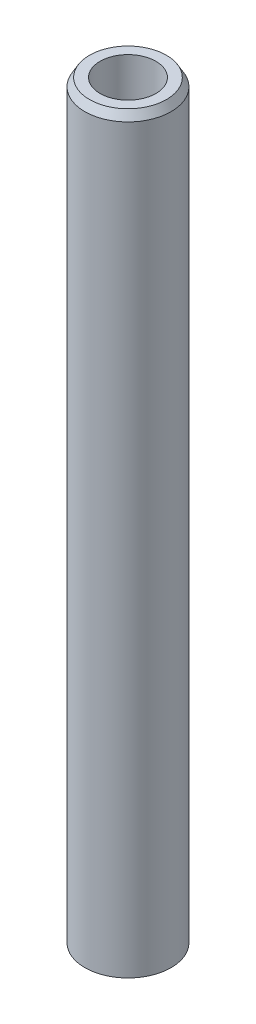
from build123d import *
from OCP.BRepFilletAPI import BRepFilletAPI_MakeChamfer

# Parameters (mm, degrees)
SKETCH1_R           = 22.5
BOSS_EXTRUDE1_DEPTH = 393.426691268
SKETCH2_R           = 14.570755287
CUT_EXTRUDE1_DEPTH  = 395.711364673
CHAMFER1_SIZE       = 4.23519954
CHAMFER1_SIZE2      = 2.445193595


with BuildPart() as part:
    # Sketch1 → Boss-Extrude1 (new body)
    with BuildSketch(Plane(origin=(0, 0, 0), x_dir=(1, 0, 0), z_dir=(0, 1, 0))):
        Circle(SKETCH1_R)
    extrude(amount=BOSS_EXTRUDE1_DEPTH)

    # Sketch2 → Cut-Extrude1 (cut, through all)
    with BuildSketch(Plane(origin=(0, 0, 0), x_dir=(1, 0, 0), z_dir=(0, 1, 0))):
        Circle(SKETCH2_R)
    extrude(amount=CUT_EXTRUDE1_DEPTH, mode=Mode.SUBTRACT)

    # Chamfer1: one chamfer whose edges measure the first distance from different faces: ONE call of the kernel's chamfer builder (chamfer() names one face for all edges)
    chamfer1_edges_1 = [part.edges().sort_by_distance(p)[0] for p in [
        (-22.5, 393.426691268, 0),
    ]]
    chamfer1_side_1 = [part.faces().sort_by_distance(p)[0] for p in [
        (-22.5, 196.713345634, 0),
    ]]
    chamfer1_edges_2 = [part.edges().sort_by_distance(p)[0] for p in [
        (-22.5, 0, 0),
    ]]
    chamfer1_side_2 = [part.faces().sort_by_distance(p)[0] for p in [
        (-21.863603897, 0, 0),
    ]]
    chamfer1 = BRepFilletAPI_MakeChamfer(part.part.solid().wrapped)
    for e in chamfer1_edges_1:
        chamfer1.Add(CHAMFER1_SIZE, CHAMFER1_SIZE2, e.wrapped, chamfer1_side_1[0].wrapped)  # the first distance lies on this face
    for e in chamfer1_edges_2:
        chamfer1.Add(CHAMFER1_SIZE, CHAMFER1_SIZE2, e.wrapped, chamfer1_side_2[0].wrapped)  # the first distance lies on this face
    add(Compound.cast(chamfer1.Shape()), mode=Mode.REPLACE)


solid = part.part
